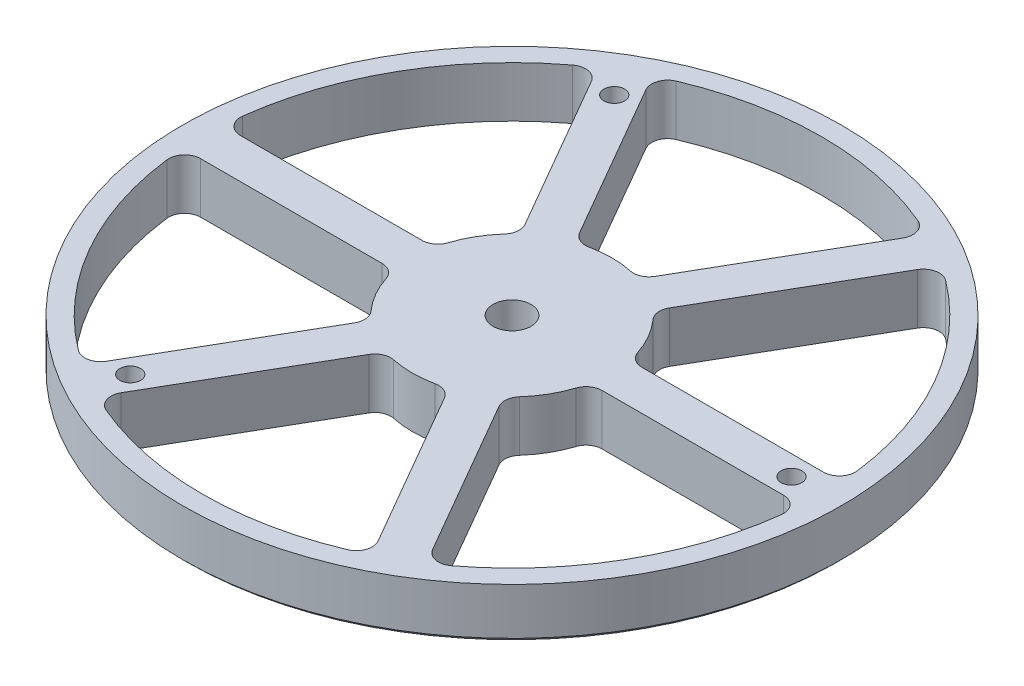
from build123d import *

# Parameters (mm, degrees)
F_6_0_204_DIAMETER_HOLE1_D   = 5.1816
CIRPATTERN3_COUNT            = 3
CUT_EXTRUDE1_DEPTH           = 118.43208675655899
FILLET1_R                    = 4
CIRPATTERN4_COUNT            = 6
FILLET1_OF_CIRPATTERN4_R     = 4
CHAMFER2_SIZE                = 1
F_3_8_0_375_DIAMETER_HOLE1_D = 9.525


with BuildPart() as part:
    # Sketch2 → Revolve1 (revolve)
    with BuildSketch(Plane(origin=(0, 0, 0), x_dir=(0, 0, -1), z_dir=(1, 0, 0))):
        Polygon((0, 0), (-82.55, -1.011e-14), (-82.55, 12.699999999999989), (0, 12.699999999999989), align=None)
    revolve(axis=Axis((0, -0.7500000000000111, 0), (0, 1, 0)))

    # #6 (0.204) Diameter Hole1 (through all)
    with Locations(Plane(origin=(0, 12.699999999999989, 0), x_dir=(1, 0, 0), z_dir=(0, 1, 0))):
        with Locations((-35, 60.621778265)):
            f_6_0_204_diameter_hole1 = Hole(F_6_0_204_DIAMETER_HOLE1_D / 2)

    # CirPattern3: #6 (0.204) Diameter Hole1 ×3 about axis
    cirpattern3_axis = Axis((0, -0.7500000000000111, 0), (0, 1, 0))
    for i in range(1, CIRPATTERN3_COUNT):
        add(f_6_0_204_diameter_hole1.rotate(cirpattern3_axis, i * 360 / CIRPATTERN3_COUNT), mode=Mode.SUBTRACT)

    # Sketch8 → Cut-Extrude1 (cut, through all)
    with BuildSketch(Plane(origin=(0, 12.699999999999989, 0), x_dir=(1, 0, 0), z_dir=(0, 1, 0))):
        with BuildLine():
            Line((-7.91732169499373, 23.713203435596423), (-34.36419588509058, 69.52053323422602))
            ThreePointArc((-34.36419588509058, 69.52053323422602), (4.75e-15, 77.55000000000001), (34.36419588509058, 69.52053323422602))
            Line((34.36419588509058, 69.52053323422602), (7.917321694993729, 23.713203435596423))
            ThreePointArc((7.917321694993729, 23.713203435596423), (1.53e-15, 25.000000000000007), (-7.91732169499373, 23.713203435596423))
        make_face()
    cut_extrude1 = extrude(amount=-CUT_EXTRUDE1_DEPTH, mode=Mode.SUBTRACT)

    # Fillet1
    fillet1_edges = [part.edges().sort_by_distance(p)[0] for p in [
        (7.9173216949937295, 6.349999999999994, -23.713203435596427),
        (34.36419588509058, 6.349999999999994, -69.52053323422604),
        (-7.9173216949937295, 6.349999999999994, -23.713203435596427),
        (-34.36419588509058, 6.349999999999994, -69.52053323422604),
    ]]
    fillet(fillet1_edges, radius=FILLET1_R)

    # CirPattern4: Cut-Extrude1 ×6 about axis
    cirpattern4_axis = Axis((0, -0.7500000000000111, 0), (0, 1, 0))
    for i in range(1, CIRPATTERN4_COUNT):
        add(cut_extrude1.rotate(cirpattern4_axis, i * 360 / CIRPATTERN4_COUNT), mode=Mode.SUBTRACT)

    # Fillet1 of CirPattern4
    fillet1_of_cirpattern4_edges = [part.edges().sort_by_distance(p)[0] for p in [
        (-16.577575732838067, 6.349999999999994, -18.713203435596455),
        (-43.02444992293479, 6.349999999999994, -64.52053323422614),
        (-24.4948974278318, 6.349999999999994, -4.999999999999974),
        (-77.38864580802537, 6.349999999999994, -4.999999999999911),
        (-24.494897427831795, 6.349999999999994, 4.999999999999966),
        (-77.38864580802539, 6.349999999999994, 4.999999999999886),
        (-16.57757573283807, 6.349999999999994, 18.713203435596448),
        (-43.024449922934814, 6.349999999999994, 64.52053323422612),
        (-7.917321694993732, 6.349999999999994, 23.713203435596427),
        (-34.36419588509059, 6.349999999999994, 69.52053323422604),
        (7.917321694993727, 6.349999999999994, 23.713203435596427),
        (34.364195885090574, 6.349999999999994, 69.52053323422604),
        (16.577575732838056, 6.349999999999994, 18.713203435596462),
        (43.024449922934764, 6.349999999999994, 64.52053323422615),
        (24.494897427831795, 6.349999999999994, 4.999999999999985),
        (77.38864580802537, 6.349999999999994, 4.99999999999994),
        (24.4948974278318, 6.349999999999994, -4.999999999999974),
        (77.38864580802537, 6.349999999999994, -4.999999999999911),
        (16.577575732838067, 6.349999999999994, -18.713203435596455),
        (43.02444992293479, 6.349999999999994, -64.52053323422614),
    ]]
    fillet(fillet1_of_cirpattern4_edges, radius=FILLET1_OF_CIRPATTERN4_R)

    # Chamfer2
    chamfer2_edges = [part.edges().sort_by_distance(p)[0] for p in [
        (4.677e-14, -1.01e-14, -82.55),
    ]]
    chamfer(chamfer2_edges, length=CHAMFER2_SIZE)

    # 3/8 (0.375) Diameter Hole1 (through all)
    with Locations(Plane(origin=(0, 0, 0), x_dir=(-1, 0, 0), z_dir=(0, -1, 0))):
        with Locations((0, 0)):
            Hole(F_3_8_0_375_DIAMETER_HOLE1_D / 2)


solid = part.part
